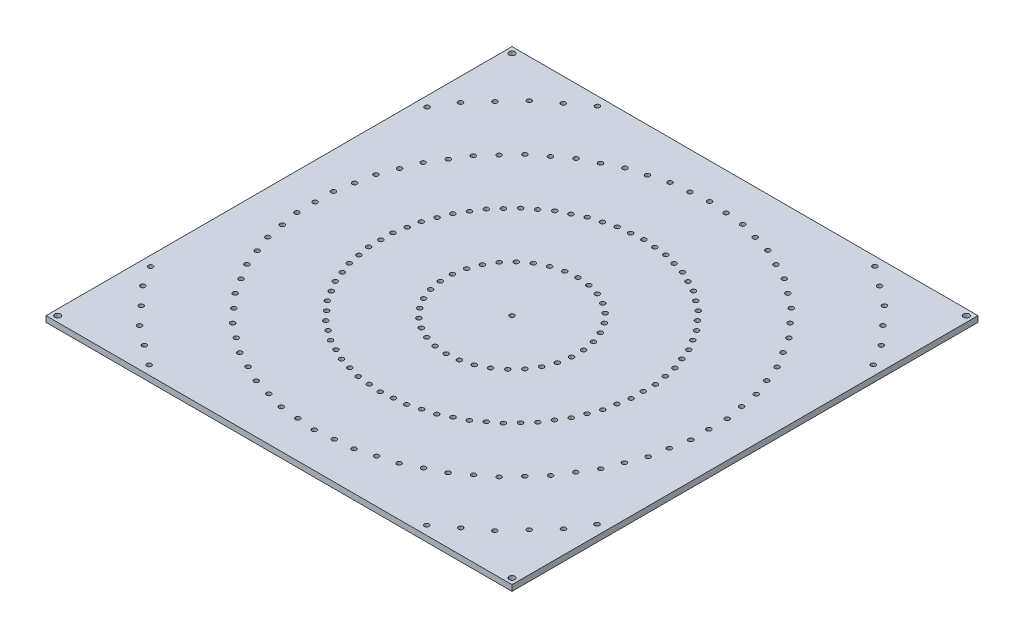
from build123d import *

# Parameters (mm, degrees)
SKETCH1_W               = 254
SKETCH1_H               = 254
BOSS_EXTRUDE1_DEPTH     = 3.175
SKETCH2_R               = 1.5875
CUT_EXTRUDE1_DEPTH      = 180.63318353
FILL_START              = -3.175
FILL_PATTERN1_OUTLINE_R = 1.27
FILL_PATTERN1_DEPTH     = 3.175
CIRPATTERN1_COUNT       = 4


# Read off the part's stored shape, not the designer's step: Fill Pattern1
with BuildPart() as part:
    # Sketch1 → Boss-Extrude1 (new body)
    with BuildSketch(Plane(origin=(0, 0, 0), x_dir=(1, 0, 0), z_dir=(0, 1, 0))):
        Rectangle(SKETCH1_W, SKETCH1_H)
    extrude(amount=-BOSS_EXTRUDE1_DEPTH)

    # Sketch2 → Cut-Extrude1 (cut, through all)
    with BuildSketch(Plane(origin=(0, 0, 0), x_dir=(1, 0, 0), z_dir=(0, 1, 0))):
        with Locations(Location((-123.825, -123.825, 0), (0, 0, 270))):
            Circle(SKETCH2_R)
    cut_extrude1 = extrude(amount=-CUT_EXTRUDE1_DEPTH, mode=Mode.SUBTRACT)

    # Fill Pattern1 outline → Fill Pattern1 (cut)
    with BuildSketch(Plane(origin=(0, 0, 0), x_dir=(1, 0, 0), z_dir=(0, 1, 0)).offset(FILL_START)):
        Circle(FILL_PATTERN1_OUTLINE_R)
        with Locations((-9.900706393, 106.845637898)):
            Circle(FILL_PATTERN1_OUTLINE_R)
        with Locations((-6.600470928, 71.230425265)):
            Circle(FILL_PATTERN1_OUTLINE_R)
        with Locations((-105.476331307, 19.716943449)):
            Circle(FILL_PATTERN1_OUTLINE_R)
        with Locations((-70.317554205, 13.144628966)):
            Circle(FILL_PATTERN1_OUTLINE_R)
        with Locations((-107.30337518, 9.943121998)):
            Circle(FILL_PATTERN1_OUTLINE_R)
        with Locations((-71.535583453, 6.628747999)):
            Circle(FILL_PATTERN1_OUTLINE_R)
        with Locations((-107.30337518, 0)):
            Circle(FILL_PATTERN1_OUTLINE_R)
        with Locations((-71.535583453, 0)):
            Circle(FILL_PATTERN1_OUTLINE_R)
        with Locations((-107.30337518, -9.943121998)):
            Circle(FILL_PATTERN1_OUTLINE_R)
        with Locations((-71.535583453, -6.628747999)):
            Circle(FILL_PATTERN1_OUTLINE_R)
        with Locations((-100.057417476, -38.762450037)):
            Circle(FILL_PATTERN1_OUTLINE_R)
        with Locations((-66.704944984, -25.841633358)):
            Circle(FILL_PATTERN1_OUTLINE_R)
        with Locations((-96.465547519, -48.034135174)):
            Circle(FILL_PATTERN1_OUTLINE_R)
        with Locations((-64.310365012, -32.022756783)):
            Circle(FILL_PATTERN1_OUTLINE_R)
        with Locations((-105.476331307, -19.716943449)):
            Circle(FILL_PATTERN1_OUTLINE_R)
        with Locations((-70.317554205, -13.144628966)):
            Circle(FILL_PATTERN1_OUTLINE_R)
        with Locations((-103.649287434, -29.4907649)):
            Circle(FILL_PATTERN1_OUTLINE_R)
        with Locations((-69.099524956, -19.660509934)):
            Circle(FILL_PATTERN1_OUTLINE_R)
        with Locations((-48.399675421, -53.091914819)):
            Circle(FILL_PATTERN1_OUTLINE_R)
        with Locations((-72.599513131, -79.637872229)):
            Circle(FILL_PATTERN1_OUTLINE_R)
        with Locations((-96.799350842, -106.183829638)):
            Circle(FILL_PATTERN1_OUTLINE_R)
        with Locations((-52.86543407, -48.193210938)):
            Circle(FILL_PATTERN1_OUTLINE_R)
        with Locations((-75.639930448, -122.162682198)):
            Circle(FILL_PATTERN1_OUTLINE_R)
        with Locations((-43.109820322, -57.086627959)):
            Circle(FILL_PATTERN1_OUTLINE_R)
        with Locations((-64.664730484, -85.629941939)):
            Circle(FILL_PATTERN1_OUTLINE_R)
        with Locations((-86.219640645, -114.173255918)):
            Circle(FILL_PATTERN1_OUTLINE_R)
        with Locations((-114.66238544, -86.589014114)):
            Circle(FILL_PATTERN1_OUTLINE_R)
        with Locations((-60.820778866, -37.65863192)):
            Circle(FILL_PATTERN1_OUTLINE_R)
        with Locations((-91.231168299, -56.48794788)):
            Circle(FILL_PATTERN1_OUTLINE_R)
        with Locations((-121.641557732, -75.31726384)):
            Circle(FILL_PATTERN1_OUTLINE_R)
        with Locations((-85.99678908, -64.941760585)):
            Circle(FILL_PATTERN1_OUTLINE_R)
        with Locations((-57.33119272, -43.294507057)):
            Circle(FILL_PATTERN1_OUTLINE_R)
        with Locations((-105.730868141, -96.386421876)):
            Circle(FILL_PATTERN1_OUTLINE_R)
        with Locations((-79.298151106, -72.289816407)):
            Circle(FILL_PATTERN1_OUTLINE_R)
        with Locations((-86.219640645, 114.173255918)):
            Circle(FILL_PATTERN1_OUTLINE_R)
        with Locations((-37.819965224, 61.081341099)):
            Circle(FILL_PATTERN1_OUTLINE_R)
        with Locations((-56.729947836, 91.622011648)):
            Circle(FILL_PATTERN1_OUTLINE_R)
        with Locations((-75.639930448, 122.162682198)):
            Circle(FILL_PATTERN1_OUTLINE_R)
        with Locations((-64.664730484, 85.629941939)):
            Circle(FILL_PATTERN1_OUTLINE_R)
        with Locations((-43.109820322, 57.086627959)):
            Circle(FILL_PATTERN1_OUTLINE_R)
        with Locations((-96.799350842, 106.183829638)):
            Circle(FILL_PATTERN1_OUTLINE_R)
        with Locations((-72.599513131, 79.637872229)):
            Circle(FILL_PATTERN1_OUTLINE_R)
        with Locations((-19.576641664, 68.804758564)):
            Circle(FILL_PATTERN1_OUTLINE_R)
        with Locations((-29.364962496, 103.207137847)):
            Circle(FILL_PATTERN1_OUTLINE_R)
        with Locations((-13.200941857, 70.618801562)):
            Circle(FILL_PATTERN1_OUTLINE_R)
        with Locations((-19.801412785, 105.928202343)):
            Circle(FILL_PATTERN1_OUTLINE_R)
        with Locations((-31.886153348, 64.036028333)):
            Circle(FILL_PATTERN1_OUTLINE_R)
        with Locations((-47.829230022, 96.054042499)):
            Circle(FILL_PATTERN1_OUTLINE_R)
        with Locations((-25.952341472, 66.990715567)):
            Circle(FILL_PATTERN1_OUTLINE_R)
        with Locations((-38.928512208, 100.48607335)):
            Circle(FILL_PATTERN1_OUTLINE_R)
        with Locations((-64.310365012, 32.022756783)):
            Circle(FILL_PATTERN1_OUTLINE_R)
        with Locations((-96.465547519, 48.034135174)):
            Circle(FILL_PATTERN1_OUTLINE_R)
        with Locations((-60.820778866, 37.65863192)):
            Circle(FILL_PATTERN1_OUTLINE_R)
        with Locations((-91.231168299, 56.48794788)):
            Circle(FILL_PATTERN1_OUTLINE_R)
        with Locations((-69.099524956, 19.660509934)):
            Circle(FILL_PATTERN1_OUTLINE_R)
        with Locations((-103.649287434, 29.4907649)):
            Circle(FILL_PATTERN1_OUTLINE_R)
        with Locations((-66.704944984, 25.841633358)):
            Circle(FILL_PATTERN1_OUTLINE_R)
        with Locations((-100.057417476, 38.762450037)):
            Circle(FILL_PATTERN1_OUTLINE_R)
        with Locations((-52.86543407, 48.193210938)):
            Circle(FILL_PATTERN1_OUTLINE_R)
        with Locations((-79.298151106, 72.289816407)):
            Circle(FILL_PATTERN1_OUTLINE_R)
        with Locations((-105.730868141, 96.386421876)):
            Circle(FILL_PATTERN1_OUTLINE_R)
        with Locations((-48.399675421, 53.091914819)):
            Circle(FILL_PATTERN1_OUTLINE_R)
        with Locations((-121.641557732, 75.31726384)):
            Circle(FILL_PATTERN1_OUTLINE_R)
        with Locations((-57.33119272, 43.294507057)):
            Circle(FILL_PATTERN1_OUTLINE_R)
        with Locations((-85.99678908, 64.941760585)):
            Circle(FILL_PATTERN1_OUTLINE_R)
        with Locations((-114.66238544, 86.589014114)):
            Circle(FILL_PATTERN1_OUTLINE_R)
        with Locations((91.231168299, 56.48794788)):
            Circle(FILL_PATTERN1_OUTLINE_R)
        with Locations((121.641557732, 75.31726384)):
            Circle(FILL_PATTERN1_OUTLINE_R)
        with Locations((28.66559636, -21.647253528)):
            Circle(FILL_PATTERN1_OUTLINE_R)
        with Locations((64.310365012, 32.022756783)):
            Circle(FILL_PATTERN1_OUTLINE_R)
        with Locations((100.057417476, 38.762450037)):
            Circle(FILL_PATTERN1_OUTLINE_R)
        with Locations((66.704944984, 25.841633358)):
            Circle(FILL_PATTERN1_OUTLINE_R)
        with Locations((24.19983771, -26.54595741)):
            Circle(FILL_PATTERN1_OUTLINE_R)
        with Locations((96.465547519, 48.034135174)):
            Circle(FILL_PATTERN1_OUTLINE_R)
        with Locations((79.298151106, 72.289816407)):
            Circle(FILL_PATTERN1_OUTLINE_R)
        with Locations((105.730868141, 96.386421876)):
            Circle(FILL_PATTERN1_OUTLINE_R)
        with Locations((34.549762478, -9.830254967)):
            Circle(FILL_PATTERN1_OUTLINE_R)
        with Locations((57.33119272, 43.294507057)):
            Circle(FILL_PATTERN1_OUTLINE_R)
        with Locations((85.99678908, 64.941760585)):
            Circle(FILL_PATTERN1_OUTLINE_R)
        with Locations((114.66238544, 86.589014114)):
            Circle(FILL_PATTERN1_OUTLINE_R)
        with Locations((32.155182506, -16.011378391)):
            Circle(FILL_PATTERN1_OUTLINE_R)
        with Locations((60.820778866, 37.65863192)):
            Circle(FILL_PATTERN1_OUTLINE_R)
        with Locations((107.30337518, 0)):
            Circle(FILL_PATTERN1_OUTLINE_R)
        with Locations((71.535583453, 0)):
            Circle(FILL_PATTERN1_OUTLINE_R)
        with Locations((0, -35.921024484)):
            Circle(FILL_PATTERN1_OUTLINE_R)
        with Locations((107.30337518, 9.943121998)):
            Circle(FILL_PATTERN1_OUTLINE_R)
        with Locations((-12.976170736, -33.495357783)):
            Circle(FILL_PATTERN1_OUTLINE_R)
        with Locations((107.30337518, -9.943121998)):
            Circle(FILL_PATTERN1_OUTLINE_R)
        with Locations((71.535583453, -6.628747999)):
            Circle(FILL_PATTERN1_OUTLINE_R)
        with Locations((-6.600470928, -35.309400781)):
            Circle(FILL_PATTERN1_OUTLINE_R)
        with Locations((12.976170736, -33.495357783)):
            Circle(FILL_PATTERN1_OUTLINE_R)
        with Locations((103.649287434, 29.4907649)):
            Circle(FILL_PATTERN1_OUTLINE_R)
        with Locations((69.099524956, 19.660509934)):
            Circle(FILL_PATTERN1_OUTLINE_R)
        with Locations((18.909982612, -30.540670549)):
            Circle(FILL_PATTERN1_OUTLINE_R)
        with Locations((70.317554205, 13.144628966)):
            Circle(FILL_PATTERN1_OUTLINE_R)
        with Locations((105.476331307, 19.716943449)):
            Circle(FILL_PATTERN1_OUTLINE_R)
        with Locations((6.600470928, -35.309400781)):
            Circle(FILL_PATTERN1_OUTLINE_R)
        with Locations((71.535583453, 6.628747999)):
            Circle(FILL_PATTERN1_OUTLINE_R)
        with Locations((13.200941857, 70.618801562)):
            Circle(FILL_PATTERN1_OUTLINE_R)
        with Locations((12.976170736, 33.495357783)):
            Circle(FILL_PATTERN1_OUTLINE_R)
        with Locations((9.900706393, 106.845637898)):
            Circle(FILL_PATTERN1_OUTLINE_R)
        with Locations((6.600470928, 71.230425265)):
            Circle(FILL_PATTERN1_OUTLINE_R)
        with Locations((0, 35.921024484)):
            Circle(FILL_PATTERN1_OUTLINE_R)
        with Locations((0, 71.842048969)):
            Circle(FILL_PATTERN1_OUTLINE_R)
        with Locations((0, 107.763073453)):
            Circle(FILL_PATTERN1_OUTLINE_R)
        with Locations((6.600470928, 35.309400781)):
            Circle(FILL_PATTERN1_OUTLINE_R)
        with Locations((28.66559636, 21.647253528)):
            Circle(FILL_PATTERN1_OUTLINE_R)
        with Locations((38.928512208, 100.48607335)):
            Circle(FILL_PATTERN1_OUTLINE_R)
        with Locations((25.952341472, 66.990715567)):
            Circle(FILL_PATTERN1_OUTLINE_R)
        with Locations((24.19983771, 26.54595741)):
            Circle(FILL_PATTERN1_OUTLINE_R)
        with Locations((19.801412785, 105.928202343)):
            Circle(FILL_PATTERN1_OUTLINE_R)
        with Locations((18.909982612, 30.540670549)):
            Circle(FILL_PATTERN1_OUTLINE_R)
        with Locations((19.576641664, 68.804758564)):
            Circle(FILL_PATTERN1_OUTLINE_R)
        with Locations((29.364962496, 103.207137847)):
            Circle(FILL_PATTERN1_OUTLINE_R)
        with Locations((64.664730484, 85.629941939)):
            Circle(FILL_PATTERN1_OUTLINE_R)
        with Locations((86.219640645, 114.173255918)):
            Circle(FILL_PATTERN1_OUTLINE_R)
        with Locations((35.767791727, 3.314373999)):
            Circle(FILL_PATTERN1_OUTLINE_R)
        with Locations((48.399675421, 53.091914819)):
            Circle(FILL_PATTERN1_OUTLINE_R)
        with Locations((72.599513131, 79.637872229)):
            Circle(FILL_PATTERN1_OUTLINE_R)
        with Locations((96.799350842, 106.183829638)):
            Circle(FILL_PATTERN1_OUTLINE_R)
        with Locations((35.767791727, -3.314373999)):
            Circle(FILL_PATTERN1_OUTLINE_R)
        with Locations((52.86543407, 48.193210938)):
            Circle(FILL_PATTERN1_OUTLINE_R)
        with Locations((31.886153348, 64.036028333)):
            Circle(FILL_PATTERN1_OUTLINE_R)
        with Locations((47.829230022, 96.054042499)):
            Circle(FILL_PATTERN1_OUTLINE_R)
        with Locations((32.155182506, 16.011378391)):
            Circle(FILL_PATTERN1_OUTLINE_R)
        with Locations((37.819965224, 61.081341099)):
            Circle(FILL_PATTERN1_OUTLINE_R)
        with Locations((56.729947836, 91.622011648)):
            Circle(FILL_PATTERN1_OUTLINE_R)
        with Locations((75.639930448, 122.162682198)):
            Circle(FILL_PATTERN1_OUTLINE_R)
        with Locations((34.549762478, 9.830254967)):
            Circle(FILL_PATTERN1_OUTLINE_R)
        with Locations((43.109820322, 57.086627959)):
            Circle(FILL_PATTERN1_OUTLINE_R)
        with Locations((29.364962496, -103.207137847)):
            Circle(FILL_PATTERN1_OUTLINE_R)
        with Locations((19.576641664, -68.804758564)):
            Circle(FILL_PATTERN1_OUTLINE_R)
        with Locations((-18.909982612, 30.540670549)):
            Circle(FILL_PATTERN1_OUTLINE_R)
        with Locations((38.928512208, -100.48607335)):
            Circle(FILL_PATTERN1_OUTLINE_R)
        with Locations((-6.600470928, 35.309400781)):
            Circle(FILL_PATTERN1_OUTLINE_R)
        with Locations((19.801412785, -105.928202343)):
            Circle(FILL_PATTERN1_OUTLINE_R)
        with Locations((13.200941857, -70.618801562)):
            Circle(FILL_PATTERN1_OUTLINE_R)
        with Locations((-12.976170736, 33.495357783)):
            Circle(FILL_PATTERN1_OUTLINE_R)
        with Locations((-28.66559636, 21.647253528)):
            Circle(FILL_PATTERN1_OUTLINE_R)
        with Locations((75.639930448, -122.162682198)):
            Circle(FILL_PATTERN1_OUTLINE_R)
        with Locations((56.729947836, -91.622011648)):
            Circle(FILL_PATTERN1_OUTLINE_R)
        with Locations((37.819965224, -61.081341099)):
            Circle(FILL_PATTERN1_OUTLINE_R)
        with Locations((31.886153348, -64.036028333)):
            Circle(FILL_PATTERN1_OUTLINE_R)
        with Locations((47.829230022, -96.054042499)):
            Circle(FILL_PATTERN1_OUTLINE_R)
        with Locations((-24.19983771, 26.54595741)):
            Circle(FILL_PATTERN1_OUTLINE_R)
        with Locations((25.952341472, -66.990715567)):
            Circle(FILL_PATTERN1_OUTLINE_R)
        with Locations((-38.928512208, -100.48607335)):
            Circle(FILL_PATTERN1_OUTLINE_R)
        with Locations((-25.952341472, -66.990715567)):
            Circle(FILL_PATTERN1_OUTLINE_R)
        with Locations((-29.364962496, -103.207137847)):
            Circle(FILL_PATTERN1_OUTLINE_R)
        with Locations((-19.576641664, -68.804758564)):
            Circle(FILL_PATTERN1_OUTLINE_R)
        with Locations((-56.729947836, -91.622011648)):
            Circle(FILL_PATTERN1_OUTLINE_R)
        with Locations((-37.819965224, -61.081341099)):
            Circle(FILL_PATTERN1_OUTLINE_R)
        with Locations((-47.829230022, -96.054042499)):
            Circle(FILL_PATTERN1_OUTLINE_R)
        with Locations((-31.886153348, -64.036028333)):
            Circle(FILL_PATTERN1_OUTLINE_R)
        with Locations((-19.801412785, -105.928202343)):
            Circle(FILL_PATTERN1_OUTLINE_R)
        with Locations((-13.200941857, -70.618801562)):
            Circle(FILL_PATTERN1_OUTLINE_R)
        with Locations((-9.900706393, -106.845637898)):
            Circle(FILL_PATTERN1_OUTLINE_R)
        with Locations((-6.600470928, -71.230425265)):
            Circle(FILL_PATTERN1_OUTLINE_R)
        with Locations((0, -107.763073453)):
            Circle(FILL_PATTERN1_OUTLINE_R)
        with Locations((0, -71.842048969)):
            Circle(FILL_PATTERN1_OUTLINE_R)
        with Locations((9.900706393, -106.845637898)):
            Circle(FILL_PATTERN1_OUTLINE_R)
        with Locations((6.600470928, -71.230425265)):
            Circle(FILL_PATTERN1_OUTLINE_R)
        with Locations((-32.155182506, -16.011378391)):
            Circle(FILL_PATTERN1_OUTLINE_R)
        with Locations((96.465547519, -48.034135174)):
            Circle(FILL_PATTERN1_OUTLINE_R)
        with Locations((64.310365012, -32.022756783)):
            Circle(FILL_PATTERN1_OUTLINE_R)
        with Locations((-28.66559636, -21.647253528)):
            Circle(FILL_PATTERN1_OUTLINE_R)
        with Locations((-34.549762478, -9.830254967)):
            Circle(FILL_PATTERN1_OUTLINE_R)
        with Locations((121.641557732, -75.31726384)):
            Circle(FILL_PATTERN1_OUTLINE_R)
        with Locations((91.231168299, -56.48794788)):
            Circle(FILL_PATTERN1_OUTLINE_R)
        with Locations((60.820778866, -37.65863192)):
            Circle(FILL_PATTERN1_OUTLINE_R)
        with Locations((69.099524956, -19.660509934)):
            Circle(FILL_PATTERN1_OUTLINE_R)
        with Locations((-18.909982612, -30.540670549)):
            Circle(FILL_PATTERN1_OUTLINE_R)
        with Locations((105.476331307, -19.716943449)):
            Circle(FILL_PATTERN1_OUTLINE_R)
        with Locations((70.317554205, -13.144628966)):
            Circle(FILL_PATTERN1_OUTLINE_R)
        with Locations((100.057417476, -38.762450037)):
            Circle(FILL_PATTERN1_OUTLINE_R)
        with Locations((66.704944984, -25.841633358)):
            Circle(FILL_PATTERN1_OUTLINE_R)
        with Locations((-24.19983771, -26.54595741)):
            Circle(FILL_PATTERN1_OUTLINE_R)
        with Locations((103.649287434, -29.4907649)):
            Circle(FILL_PATTERN1_OUTLINE_R)
        with Locations((-34.549762478, 9.830254967)):
            Circle(FILL_PATTERN1_OUTLINE_R)
        with Locations((96.799350842, -106.183829638)):
            Circle(FILL_PATTERN1_OUTLINE_R)
        with Locations((72.599513131, -79.637872229)):
            Circle(FILL_PATTERN1_OUTLINE_R)
        with Locations((48.399675421, -53.091914819)):
            Circle(FILL_PATTERN1_OUTLINE_R)
        with Locations((-32.155182506, 16.011378391)):
            Circle(FILL_PATTERN1_OUTLINE_R)
        with Locations((86.219640645, -114.173255918)):
            Circle(FILL_PATTERN1_OUTLINE_R)
        with Locations((64.664730484, -85.629941939)):
            Circle(FILL_PATTERN1_OUTLINE_R)
        with Locations((43.109820322, -57.086627959)):
            Circle(FILL_PATTERN1_OUTLINE_R)
        with Locations((-35.767791727, -3.314373999)):
            Circle(FILL_PATTERN1_OUTLINE_R)
        with Locations((114.66238544, -86.589014114)):
            Circle(FILL_PATTERN1_OUTLINE_R)
        with Locations((85.99678908, -64.941760585)):
            Circle(FILL_PATTERN1_OUTLINE_R)
        with Locations((57.33119272, -43.294507057)):
            Circle(FILL_PATTERN1_OUTLINE_R)
        with Locations((-35.767791727, 3.314373999)):
            Circle(FILL_PATTERN1_OUTLINE_R)
        with Locations((105.730868141, -96.386421876)):
            Circle(FILL_PATTERN1_OUTLINE_R)
        with Locations((79.298151106, -72.289816407)):
            Circle(FILL_PATTERN1_OUTLINE_R)
        with Locations((52.86543407, -48.193210938)):
            Circle(FILL_PATTERN1_OUTLINE_R)
    extrude(amount=FILL_PATTERN1_DEPTH, mode=Mode.SUBTRACT)

    # CirPattern1: Cut-Extrude1 ×4 about axis
    cirpattern1_axis = Axis((0, 0, 0), (0, 1, 0))
    for i in range(1, CIRPATTERN1_COUNT):
        add(cut_extrude1.rotate(cirpattern1_axis, i * 360 / CIRPATTERN1_COUNT), mode=Mode.SUBTRACT)


solid = part.part
